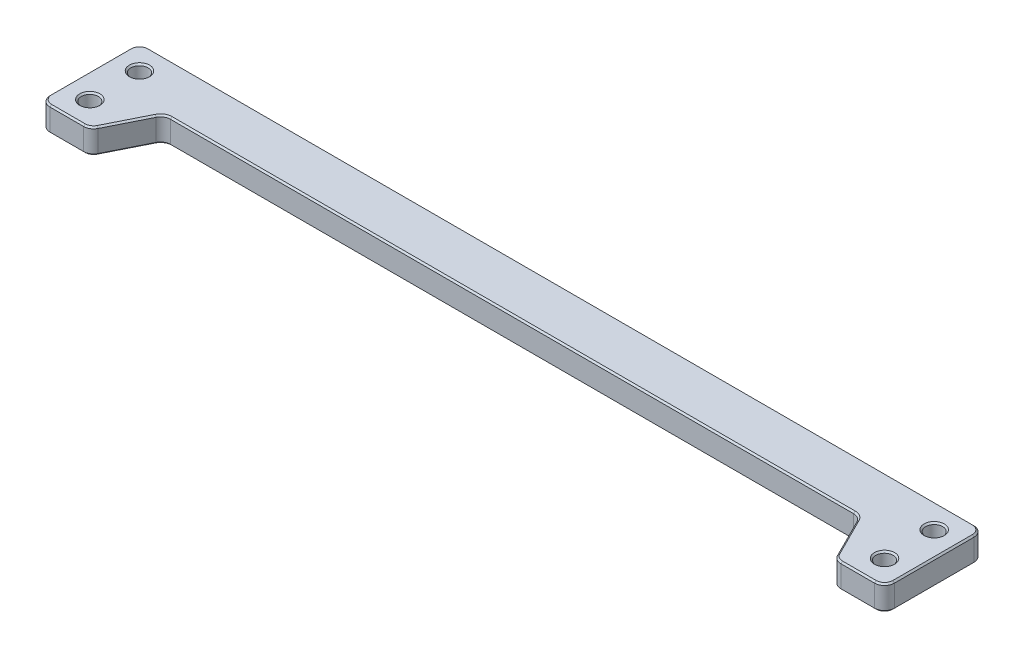
from build123d import *

# Parameters (mm, degrees)
SKETCH1_R           = 2.1828125
BOSS_EXTRUDE1_DEPTH = 3.175
CHAMFER1_SIZE       = 0.396875


with BuildPart() as part:
    # Sketch1 → Boss-Extrude1 (new, symmetric)
    with BuildSketch(Plane(origin=(0, 0, 0), x_dir=(1, 0, 0), z_dir=(0, 1, 0))):
        with BuildLine():
            Line((-3.81, 6.35), (207.01, 6.35))
            ThreePointArc((207.01, 6.35), (208.806051224, 5.606051224), (209.55, 3.81))
            Line((209.55, 3.81), (209.55, -16.51))
            ThreePointArc((209.55, -16.51), (208.806051224, -18.306051224), (207.01, -19.05))
            Line((207.01, -19.05), (198.419806331, -19.05))
            ThreePointArc((198.419806331, -19.05), (197.084449307, -18.670653053), (196.147961266, -17.645922533))
            Line((196.147961266, -17.645922533), (191.202038734, -7.754077467))
            ThreePointArc((191.202038734, -7.754077467), (190.265550693, -6.729346947), (188.930193669, -6.35))
            Line((188.930193669, -6.35), (14.269806331, -6.35))
            ThreePointArc((14.269806331, -6.35), (12.934449307, -6.729346947), (11.997961266, -7.754077467))
            Line((11.997961266, -7.754077467), (7.052038734, -17.645922533))
            ThreePointArc((7.052038734, -17.645922533), (6.115550693, -18.670653053), (4.780193669, -19.05))
            Line((4.780193669, -19.05), (-3.81, -19.05))
            ThreePointArc((-3.81, -19.05), (-5.606051224, -18.306051224), (-6.35, -16.51))
            Line((-6.35, -16.51), (-6.35, 3.81))
            ThreePointArc((-6.35, 3.81), (-5.606051224, 5.606051224), (-3.81, 6.35))
        make_face()
        Circle(SKETCH1_R, mode=Mode.SUBTRACT)
        with Locations((0, -12.7)):
            Circle(SKETCH1_R, mode=Mode.SUBTRACT)
        with Locations((203.2, 0)):
            Circle(SKETCH1_R, mode=Mode.SUBTRACT)
        with Locations((203.2, -12.7)):
            Circle(SKETCH1_R, mode=Mode.SUBTRACT)
    extrude(amount=BOSS_EXTRUDE1_DEPTH, both=True)

    # Chamfer1
    chamfer1_edges = [part.edges().sort_by_distance(p)[0] for p in [
        (201.0171875, -3.175, 12.7),
        (-2.1828125, -3.175, 12.7),
        (101.6, -3.175, -6.35),
        (-5.606051224, -3.175, -5.606051224),
        (-6.35, -3.175, 6.35),
        (-5.606051224, -3.175, 18.306051224),
        (0.485096834, -3.175, 19.05),
        (6.115550693, -3.175, 18.670653053),
        (9.525, -3.175, 12.7),
        (12.934449307, -3.175, 6.729346947),
        (101.6, -3.175, 6.35),
        (190.265550693, -3.175, 6.729346947),
        (193.675, -3.175, 12.7),
        (197.084449307, -3.175, 18.670653053),
        (202.714903166, -3.175, 19.05),
        (208.806051224, -3.175, 18.306051224),
        (209.55, -3.175, 6.35),
        (208.806051224, -3.175, -5.606051224),
        (-2.1828125, -3.175, 0),
        (201.0171875, -3.175, 0),
        (201.0171875, 3.175, 12.7),
        (201.0171875, 3.175, 0),
        (-2.1828125, 3.175, 12.7),
        (-2.1828125, 3.175, 0),
        (209.55, 3.175, 6.35),
        (208.806051224, 3.175, 18.306051224),
        (202.714903166, 3.175, 19.05),
        (197.084449307, 3.175, 18.670653053),
        (193.675, 3.175, 12.7),
        (190.265550693, 3.175, 6.729346947),
        (101.6, 3.175, 6.35),
        (12.934449307, 3.175, 6.729346947),
        (9.525, 3.175, 12.7),
        (6.115550693, 3.175, 18.670653053),
        (0.485096834, 3.175, 19.05),
        (-5.606051224, 3.175, 18.306051224),
        (-6.35, 3.175, 6.35),
        (-5.606051224, 3.175, -5.606051224),
        (101.6, 3.175, -6.35),
        (208.806051224, 3.175, -5.606051224),
    ]]
    chamfer(chamfer1_edges, length=CHAMFER1_SIZE)


solid = part.part
